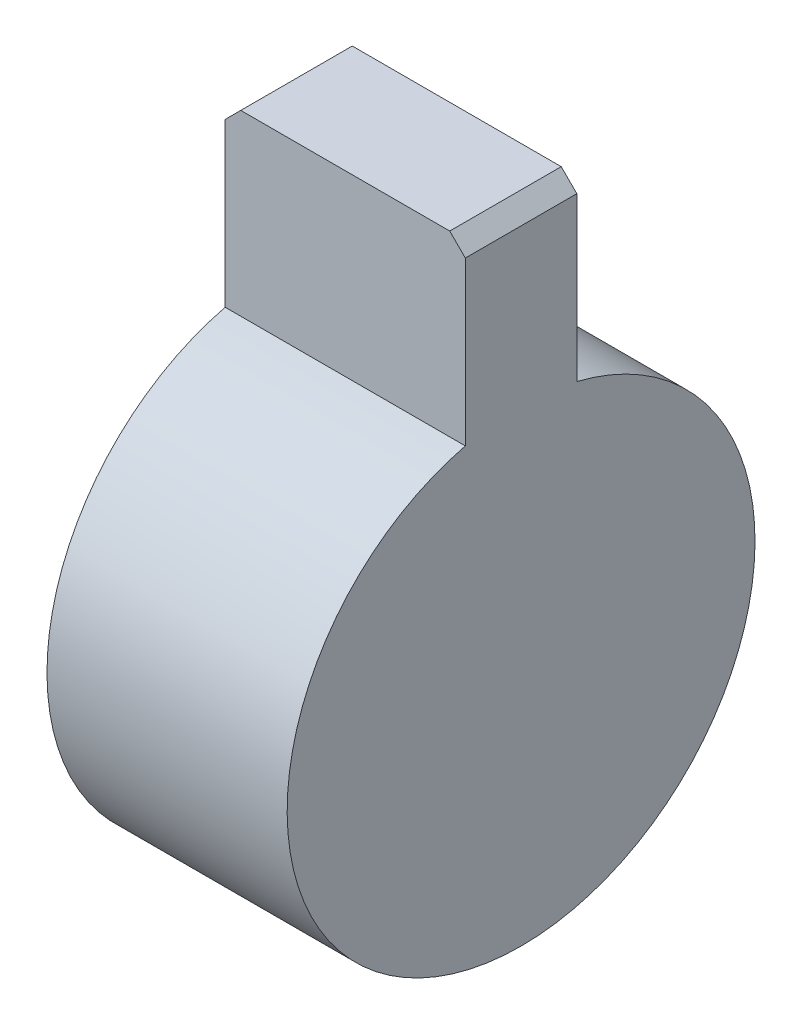
from build123d import *

# Parameters (mm, degrees)
BOSS_EXTRUDE1_DEPTH = 15.4
CHAMFER1_SIZE       = 1


with BuildPart() as part:
    # Sketch1 → Boss-Extrude1 (new body)
    with BuildSketch(Plane(origin=(0, 0, 0), x_dir=(0, 0, -1), z_dir=(1, 0, 0))):
        with BuildLine():
            Line((-3.575, 14.567751199), (-3.575, 26))
            Line((-3.575, 26), (3.575, 26))
            Line((3.575, 26), (3.575, 14.567751199))
            ThreePointArc((3.575, 14.567751199), (0, -15), (-3.575, 14.567751199))
        make_face()
    extrude(amount=BOSS_EXTRUDE1_DEPTH)

    # Chamfer1
    chamfer1_edges = [part.edges().sort_by_distance(p)[0] for p in [
        (15.4, 26, 0),
        (0, 26, 0),
    ]]
    chamfer(chamfer1_edges, length=CHAMFER1_SIZE)


solid = part.part
